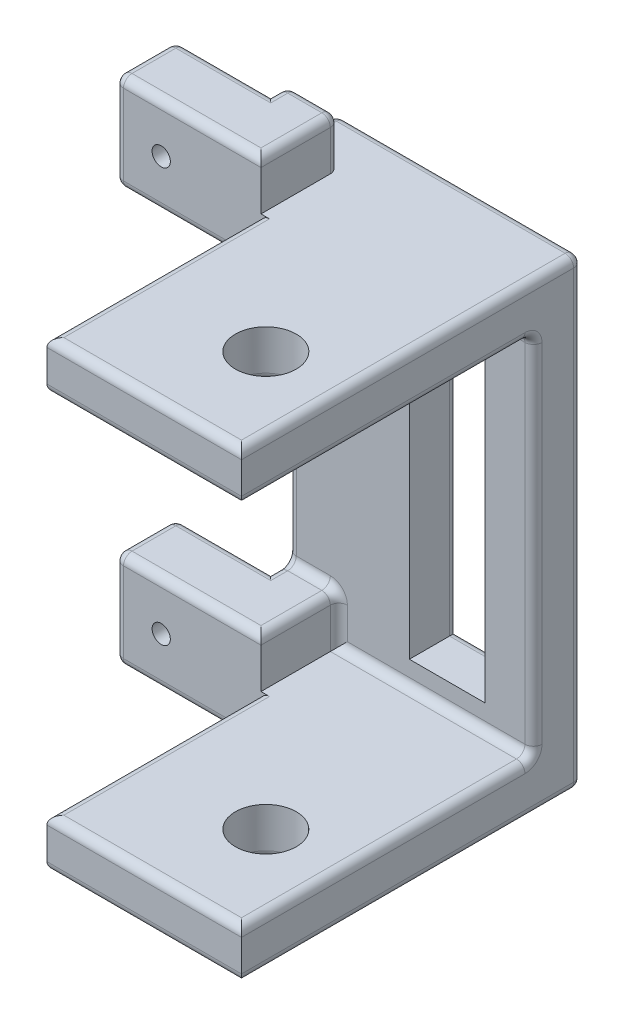
from build123d import *

# Parameters (mm, degrees)
SKETCH_2_W          = 12
SKETCH_2_H          = 19
SKETCH_2_W_2        = 3.1
SKETCH_2_H_2        = 13
EXTRUDE_1_DEPTH     = 2
SKETCH_3_W          = 8
SKETCH_3_H          = 2
EXTRUDE_2_DEPTH     = 12
SKETCH_10_W         = 6
SKETCH_10_H         = 4
EXTRUDE_4_DEPTH     = 3.2
CUT_EXTRUDE_2_REACH = 23.603
CUT_EXTRUDE_START   = 3.2
SKETCH_9_R          = 0.375
SKETCH_11_R         = 1.25
CUT_EXTRUDE_3_DEPTH = 27.446360808
CUT_EXTRUDE_4_REACH = 28.446
SKETCH_12_W         = 3.9
SKETCH_12_H         = 2.7
FILLET_1_R          = 0.35


with BuildPart() as part:
    # 草图2 → 凸台-拉伸1 (new body)
    with BuildSketch(Plane.XY):
        with Locations((0.1, 0)):
            Rectangle(SKETCH_2_W, SKETCH_2_H)
        with Locations((2.55, 0)):
            Rectangle(SKETCH_2_W_2, SKETCH_2_H_2, mode=Mode.SUBTRACT)
    extrude(amount=EXTRUDE_1_DEPTH)

    # 草图3 → 凸台-拉伸2 (add)
    with BuildSketch(Plane.XY.offset(2)):
        with Locations((2.1, 8.5)):
            Rectangle(SKETCH_3_W, SKETCH_3_H)
        with Locations((2.1, -8.5)):
            Rectangle(SKETCH_3_W, SKETCH_3_H)
    extrude(amount=EXTRUDE_2_DEPTH)

    # 草图10 → 凸台-拉伸4 (add)
    with BuildSketch(Plane.XY.offset(2)):
        with Locations((-4.9, 9.5)):
            Rectangle(SKETCH_10_W, SKETCH_10_H)
        with Locations((-4.9, -7.5)):
            Rectangle(SKETCH_10_W, SKETCH_10_H)
    extrude(amount=EXTRUDE_4_DEPTH)

    # 草图9 → 切除-拉伸2 (cut, up to next)
    with BuildSketch(Plane.XY.offset(2).offset(CUT_EXTRUDE_START), mode=Mode.PRIVATE) as cut_extrude_2_sk1:
        with Locations((-6, 9.5)):
            Circle(SKETCH_9_R)
    cut_extrude_2_tool1 = extrude(cut_extrude_2_sk1.sketch, amount=-CUT_EXTRUDE_2_REACH, mode=Mode.PRIVATE) & part.part
    # 草图9 → 切除-拉伸2 (cut, up to next)
    with BuildSketch(Plane.XY.offset(2).offset(CUT_EXTRUDE_START), mode=Mode.PRIVATE) as cut_extrude_2_sk2:
        with Locations((-6, -7.5)):
            Circle(SKETCH_9_R)
    cut_extrude_2_tool2 = extrude(cut_extrude_2_sk2.sketch, amount=-CUT_EXTRUDE_2_REACH, mode=Mode.PRIVATE) & part.part
    add(cut_extrude_2_tool1.solids().sort_by_distance((-6, 9.5, 5.2))[0], mode=Mode.SUBTRACT)
    add(cut_extrude_2_tool2.solids().sort_by_distance((-6, -7.5, 5.2))[0], mode=Mode.SUBTRACT)

    # 草图11 → 切除-拉伸3 (cut, through all)
    with BuildSketch(Plane.XZ.offset(9.5)):
        with Locations((3.1, 10)):
            Circle(SKETCH_11_R)
    extrude(amount=-CUT_EXTRUDE_3_DEPTH, mode=Mode.SUBTRACT)

    # 草图12 → 切除-拉伸4 (cut, up to next)
    with BuildSketch(Plane.XZ.offset(9.5), mode=Mode.PRIVATE) as cut_extrude_4_sk1:
        with Locations((-5.95, 1.35)):
            Rectangle(SKETCH_12_W, SKETCH_12_H)
    cut_extrude_4_tool1 = extrude(cut_extrude_4_sk1.sketch, amount=-CUT_EXTRUDE_4_REACH, mode=Mode.PRIVATE) & part.part
    add(cut_extrude_4_tool1.solids().sort_by_distance((-5.95, -9.5, 1.35))[0], mode=Mode.SUBTRACT)

    # 圆角1
    fillet_1_edges = [part.edges().sort_by_distance(p)[0] for p in [
        (-1.9, -6.5, 2),
        (6.1, 0, 2),
        (-4, 1, 2),
        (1, 0, 0),
        (2.55, 6.5, 0),
        (4.1, 0, 0),
        (2.55, -6.5, 0),
        (6.1, 0, 0),
        (1.05, 9.5, 0),
        (-4, 0, 0),
        (-4.9, -9.5, 5.2),
        (-1.9, -9.5, 9.6),
        (2.1, -9.5, 14),
        (6.1, -9.5, 7),
        (1.05, -9.5, 0),
        (-4, -9.5, 1.35),
        (-5.95, -9.5, 2.7),
        (1.85, -9.5, 10),
        (-1.9, -5.5, 3.6),
        (-4.9, -5.5, 5.2),
        (-5.95, -5.5, 2.7),
        (-4, -5.5, 2.35),
        (-2.95, -5.5, 2),
        (-7.9, -7.5, 5.2),
        (-7.9, -9.5, 3.95),
        (-7.9, -7.5, 2.7),
        (-7.9, -5.5, 3.95),
        (-4.9, 7.5, 5.2),
        (-1.9, 7.5, 9.6),
        (2.1, 7.5, 14),
        (6.1, 7.5, 8),
        (1.05, 7.5, 2),
        (-4, 7.5, 2.35),
        (-5.95, 7.5, 2.7),
        (1.85, 7.5, 10),
        (-2.95, 11.5, 2),
        (-1.9, 11.5, 3.6),
        (-4.9, 11.5, 5.2),
        (-5.95, 11.5, 2.7),
        (-4, 11.5, 2.35),
        (-7.9, 9.5, 5.2),
        (-7.9, 7.5, 3.95),
        (-7.9, 9.5, 2.7),
        (-7.9, 11.5, 3.95),
        (-4, 10.5, 2),
        (-1.9, 10.5, 2),
        (-4, 9.5, 1),
        (2.1, 9.5, 14),
        (6.1, 9.5, 7),
        (-1.9, 9.5, 9.6),
        (2.1, -7.5, 2),
        (6.1, -7.5, 8),
        (-1.9, -7.5, 9.6),
        (2.1, -7.5, 14),
    ]]
    fillet(fillet_1_edges, radius=FILLET_1_R)


solid = part.part
